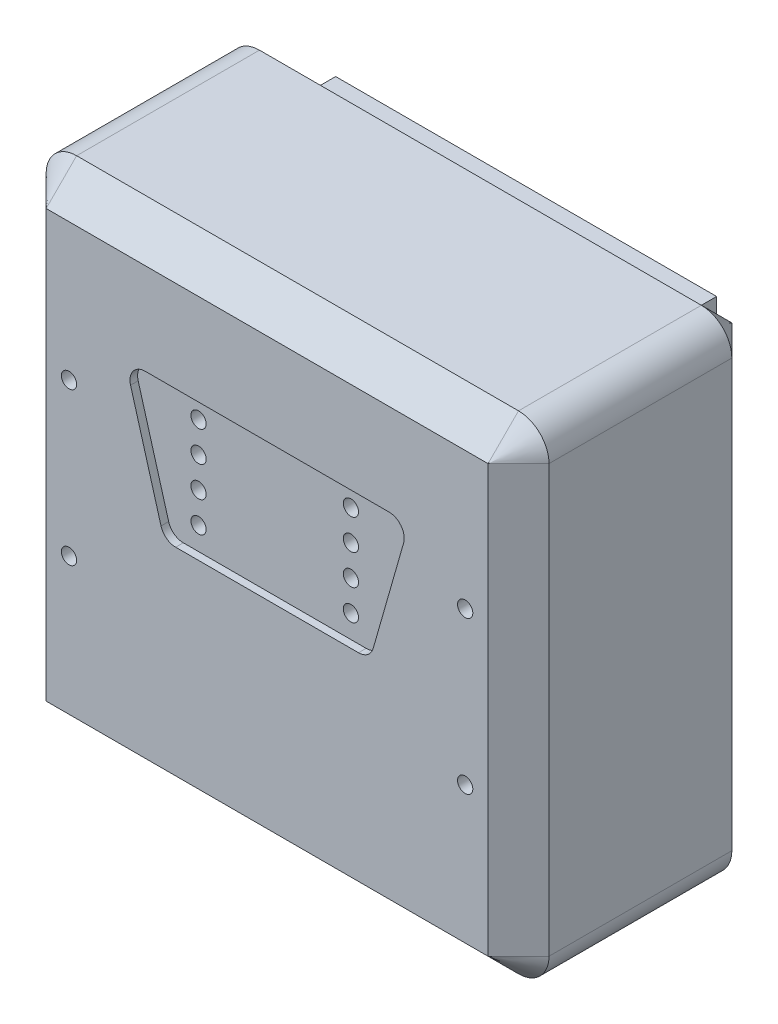
from build123d import *

# Parameters (mm, degrees)
SKETCH1_W           = 158.75
SKETCH1_H           = 50.8
SKETCH1_R           = 1.5875
BOSS_EXTRUDE1_DEPTH = 6.35
BOSS_EXTRUDE2_DEPTH = 101.6
CHAMFER1_SIZE       = 12.7
SKETCH3_R           = 3.175
CUT_EXTRUDE3_DEPTH  = 31.75
CUT_EXTRUDE4_DEPTH  = 3.175
SKETCH5_R           = 3.175
CUT_EXTRUDE5_DEPTH  = 12.7
SKETCH6_R           = 6.35
BOSS_EXTRUDE3_DEPTH = 29.845
BOSS_EXTRUDE4_DEPTH = 6.35
SKETCH8_R           = 6.35
BOSS_EXTRUDE5_DEPTH = 12.7


with BuildPart() as part:
    # Sketch1 → Boss-Extrude1 (new body)
    with BuildSketch(Plane.XY):
        with Locations((0, 25.4)):
            Rectangle(SKETCH1_W, SKETCH1_H)
        with Locations((53.975, 38.1)):
            Circle(SKETCH1_R, mode=Mode.SUBTRACT)
        with Locations(Location((53.975, 12.7, 0), (0, 0, 180))):
            Circle(SKETCH1_R, mode=Mode.SUBTRACT)
        with Locations((-53.975, 12.7)):
            Circle(SKETCH1_R, mode=Mode.SUBTRACT)
        with Locations(Location((-53.975, 38.1, 0), (0, 0, 180))):
            Circle(SKETCH1_R, mode=Mode.SUBTRACT)
        with Locations((0, 25.4)):
            Circle(SKETCH1_R, mode=Mode.SUBTRACT)
    extrude(amount=BOSS_EXTRUDE1_DEPTH)

    # Sketch2 → Boss-Extrude2 (add)
    with BuildSketch(Plane.XY.offset(6.35)):
        with BuildLine():
            Line((-92.075, -139.7), (92.075, -139.7))
            ThreePointArc((92.075, -139.7), (101.055256121, -135.980256121), (104.775, -127))
            Line((104.775, -127), (104.775, 50.8))
            ThreePointArc((104.775, 50.8), (101.055256121, 59.780256121), (92.075, 63.5))
            Line((92.075, 63.5), (-92.075, 63.5))
            ThreePointArc((-92.075, 63.5), (-101.055256121, 59.780256121), (-104.775, 50.8))
            Line((-104.775, 50.8), (-104.775, -127))
            ThreePointArc((-104.775, -127), (-101.055256121, -135.980256121), (-92.075, -139.7))
        make_face()
    extrude(amount=BOSS_EXTRUDE2_DEPTH)

    # Chamfer1
    chamfer1_edges = [part.edges().sort_by_distance(p)[0] for p in [
        (-101.055256121, -135.980256121, 6.35),
        (0, -139.7, 6.35),
        (101.055256121, -135.980256121, 6.35),
        (104.775, -38.1, 6.35),
        (101.055256121, 59.780256121, 6.35),
        (0, 63.5, 6.35),
        (-101.055256121, 59.780256121, 6.35),
        (-104.775, -38.1, 6.35),
        (-101.055256121, -135.980256121, 107.95),
        (0, -139.7, 107.95),
        (101.055256121, -135.980256121, 107.95),
        (104.775, -38.1, 107.95),
        (101.055256121, 59.780256121, 107.95),
        (0, 63.5, 107.95),
        (-101.055256121, 59.780256121, 107.95),
        (-104.775, -38.1, 107.95),
    ]]
    chamfer(chamfer1_edges, length=CHAMFER1_SIZE - 0.0001)  # a hair under: the kernel refuses the full size

    # Sketch3 → Cut-Extrude3 (cut)
    with BuildSketch(Plane.XY.offset(107.95)):
        with Locations((-82.55, -6.35)):
            Circle(SKETCH3_R)
        with Locations(Location((-82.55, -69.85, 0), (0, 0, 180))):
            Circle(SKETCH3_R)
        with Locations((82.55, -69.85)):
            Circle(SKETCH3_R)
        with Locations(Location((82.55, -6.35, 0), (0, 0, 180))):
            Circle(SKETCH3_R)
    extrude(amount=-CUT_EXTRUDE3_DEPTH, mode=Mode.SUBTRACT)

    # Sketch4 → Cut-Extrude4 (cut)
    with BuildSketch(Plane.XY.offset(107.95)):
        with BuildLine():
            Line((50.8, 12.7), (-50.8, 12.7))
            ThreePointArc((-50.8, 12.7), (-55.869513916, 10.173941508), (-56.905677068, 4.605520838))
            Line((-56.905677068, 4.605520838), (-44.205677068, -39.844479162))
            ThreePointArc((-44.205677068, -39.844479162), (-41.923941508, -43.169513916), (-38.1, -44.45))
            Line((-38.1, -44.45), (38.1, -44.45))
            ThreePointArc((38.1, -44.45), (41.923941508, -43.169513916), (44.205677068, -39.844479162))
            Line((44.205677068, -39.844479162), (56.905677068, 4.605520838))
            ThreePointArc((56.905677068, 4.605520838), (55.869513916, 10.173941508), (50.8, 12.7))
        make_face()
    extrude(amount=-CUT_EXTRUDE4_DEPTH, mode=Mode.SUBTRACT)

    # Sketch5 → Cut-Extrude5 (cut)
    with BuildSketch(Plane.XY.offset(104.775)):
        with Locations((-31.75, 3.175)):
            Circle(SKETCH5_R)
        with Locations((-31.75, -9.525)):
            Circle(SKETCH5_R)
        with Locations((-31.75, -22.225)):
            Circle(SKETCH5_R)
        with Locations((-31.75, -34.925)):
            Circle(SKETCH5_R)
        with Locations(Location((31.75, -34.925, 0), (0, 0, 180))):
            Circle(SKETCH5_R)
        with Locations(Location((31.75, -22.225, 0), (0, 0, 180))):
            Circle(SKETCH5_R)
        with Locations(Location((31.75, -9.525, 0), (0, 0, 180))):
            Circle(SKETCH5_R)
        with Locations(Location((31.75, 3.175, 0), (0, 0, 180))):
            Circle(SKETCH5_R)
    extrude(amount=-CUT_EXTRUDE5_DEPTH, mode=Mode.SUBTRACT)

    # Sketch6 → Boss-Extrude3 (add)
    with BuildSketch(Plane(origin=(0, 0, 6.35), x_dir=(-1, 0, 0), z_dir=(0, 0, -1))):
        with Locations(Location((0, -101.6, 0), (0, 0, 180))):
            Circle(SKETCH6_R)
    extrude(amount=BOSS_EXTRUDE3_DEPTH)

    # Sketch7 → Boss-Extrude4 (add)
    with BuildSketch(Plane(origin=(0, 0, -23.495), x_dir=(-1, 0, 0), z_dir=(0, 0, -1))):
        with BuildLine():
            Line((-4.445, -106.134807052), (4.445, -106.134807052))
            Line((4.445, -106.134807052), (4.445, -97.065192948))
            ThreePointArc((4.445, -97.065192948), (-4.534807052, -97.155), (-4.445, -106.134807052))
        make_face()
    extrude(amount=BOSS_EXTRUDE4_DEPTH)

    # Sketch8 → Boss-Extrude5 (add)
    with BuildSketch(Plane(origin=(0, 0, -29.845), x_dir=(-1, 0, 0), z_dir=(0, 0, -1))):
        with Locations((0, -101.6)):
            Circle(SKETCH8_R)
    extrude(amount=BOSS_EXTRUDE5_DEPTH)


solid = part.part
